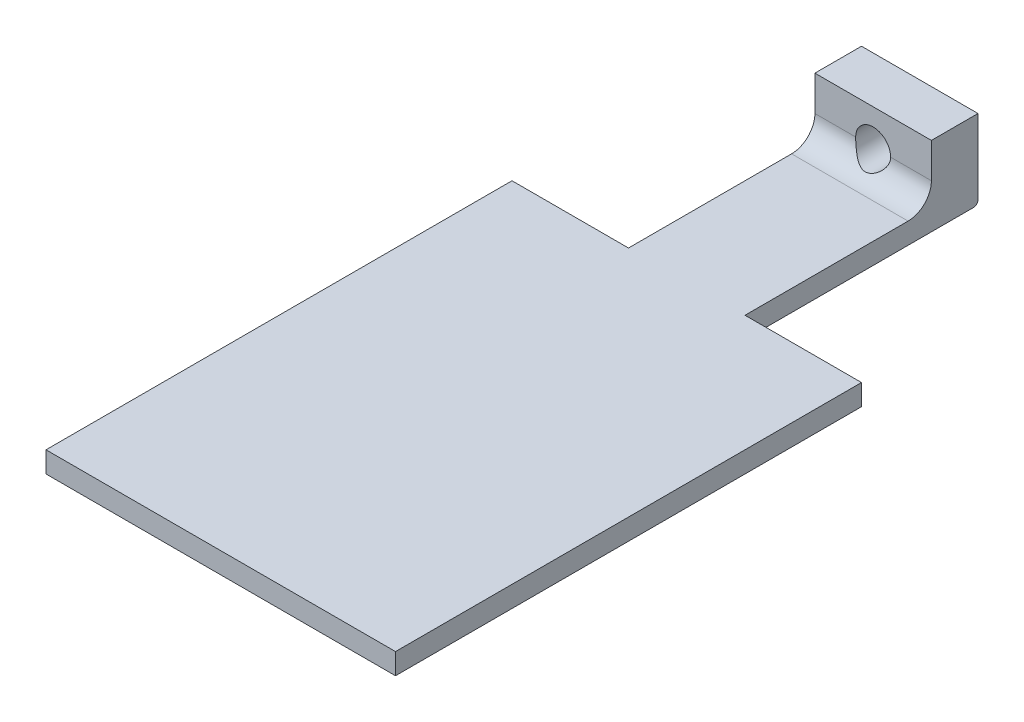
from build123d import *

# Parameters (mm, degrees)
BOSS_EXTRUDE1_DEPTH = 1.8
SKETCH2_W           = 10
SKETCH2_H           = 4
BOSS_EXTRUDE2_DEPTH = 5
SKETCH3_R           = 1.5
CUT_EXTRUDE1_DEPTH  = 5
FILLET1_R           = 2
FILLET2_R           = 0.4


with BuildPart() as part:
    # Sketch1 → Boss-Extrude1 (new body)
    with BuildSketch(Plane(origin=(0, 0, 0), x_dir=(1, 0, 0), z_dir=(0, 1, 0))):
        Polygon((20, 0), (30, 0), (30, -40), (0, -40), (0, 0), (10, 0), (10, 20), (20, 20), align=None)
    extrude(amount=BOSS_EXTRUDE1_DEPTH)

    # Sketch2 → Boss-Extrude2 (add)
    with BuildSketch(Plane(origin=(0, 1.8, 0), x_dir=(1, 0, 0), z_dir=(0, 1, 0))):
        with Locations((15, 18)):
            Rectangle(SKETCH2_W, SKETCH2_H)
    extrude(amount=BOSS_EXTRUDE2_DEPTH)

    # Sketch3 → Cut-Extrude1 (cut)
    with BuildSketch(Plane(origin=(0, 0, -20), x_dir=(-1, 0, 0), z_dir=(0, 0, -1))):
        with Locations((-15, 3.8)):
            Circle(SKETCH3_R)
    extrude(amount=-CUT_EXTRUDE1_DEPTH, mode=Mode.SUBTRACT)

    # Fillet1
    # the kernel refuses this fillet: 2 mm, written as the material it adds along each edge
    with BuildSketch(Plane(origin=(20, 1.8, -16), x_dir=(0, 0, 1), z_dir=(-1, 0, 0))) as fillet1_piece_1_section:
        with BuildLine():
            CenterArc((FILLET1_R, FILLET1_R), FILLET1_R, 180, 90)
            Line((0, FILLET1_R), (0, 0))
            Line((0, 0), (FILLET1_R, 0))
        make_face()
    fillet1_piece_1 = extrude(amount=10, mode=Mode.PRIVATE)
    fillet1_piece_1 = fillet1_piece_1 - Plane(origin=(15, 3.8, -15.523581598), x_dir=(-1, 0, 0), z_dir=(0, 0, -1)) * Cylinder(1.5, 28, mode=Mode.PRIVATE)
    add(fillet1_piece_1)

    # Fillet2
    fillet2_edges = [part.edges().sort_by_distance(p)[0] for p in [
        (15, 0, -20),
    ]]
    fillet(fillet2_edges, radius=FILLET2_R)


solid = part.part
